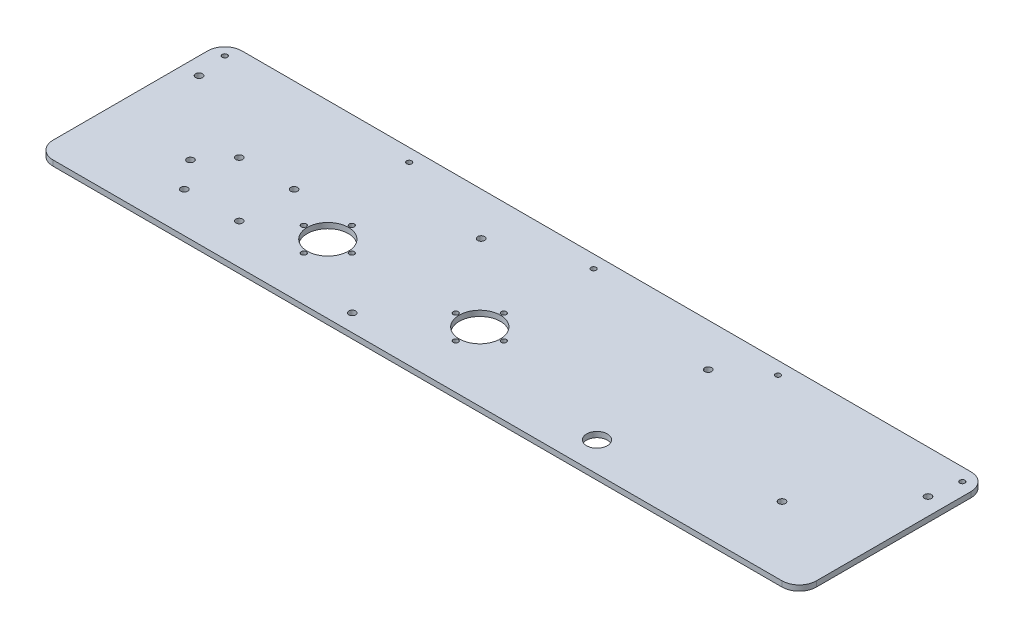
from build123d import *

# Parameters (mm, degrees)
SKETCH1_R           = 2
SKETCH1_R_2         = 1.5
SKETCH1_R_3         = 6
SKETCH1_R_4         = 12
BOSS_EXTRUDE1_DEPTH = 3.175
FILLET1_R           = 10
SKETCH2_R           = 2
CUT_EXTRUDE1_DEPTH  = 10


with BuildPart() as part:
    # Sketch1 → Boss-Extrude1 (new body)
    with BuildSketch(Plane(origin=(0, 0, 0), x_dir=(1, 0, 0), z_dir=(0, 1, 0))):
        Polygon((-26.799577535, 0), (417.700422465, 0), (417.700422465, 17.22815868), (417.700422465, 110), (-26.799577535, 110), align=None)
        with Locations((23.200422465, 40)):
            Circle(SKETCH1_R, mode=Mode.SUBTRACT)
        with Locations((89.200422465, 40)):
            Circle(SKETCH1_R_2, mode=Mode.SUBTRACT)
        with Locations((103.200422465, 26)):
            Circle(SKETCH1_R_2, mode=Mode.SUBTRACT)
        with Locations((117.200422465, 40)):
            Circle(SKETCH1_R_2, mode=Mode.SUBTRACT)
        with Locations((177.700422465, 40)):
            Circle(SKETCH1_R_2, mode=Mode.SUBTRACT)
        with Locations((191.700422465, 26)):
            Circle(SKETCH1_R_2, mode=Mode.SUBTRACT)
        with Locations((205.700422465, 40)):
            Circle(SKETCH1_R_2, mode=Mode.SUBTRACT)
        with Locations((367.700422465, 40)):
            Circle(SKETCH1_R, mode=Mode.SUBTRACT)
        with Locations((147.450422465, 10)):
            Circle(SKETCH1_R, mode=Mode.SUBTRACT)
        with Locations((282.700422465, 17.22815868)):
            Circle(SKETCH1_R_3, mode=Mode.SUBTRACT)
        with Locations((-16.799577535, 85)):
            Circle(SKETCH1_R, mode=Mode.SUBTRACT)
        with Locations((147.450422465, 85)):
            Circle(SKETCH1_R, mode=Mode.SUBTRACT)
        with Locations((103.200422465, 54)):
            Circle(SKETCH1_R_2, mode=Mode.SUBTRACT)
        with Locations((103.200422465, 40)):
            Circle(SKETCH1_R_4, mode=Mode.SUBTRACT)
        with Locations((279.700422465, 85)):
            Circle(SKETCH1_R, mode=Mode.SUBTRACT)
        with Locations((191.700422465, 54)):
            Circle(SKETCH1_R_2, mode=Mode.SUBTRACT)
        with Locations((191.700422465, 40)):
            Circle(SKETCH1_R_4, mode=Mode.SUBTRACT)
        with Locations((407.700422465, 85)):
            Circle(SKETCH1_R, mode=Mode.SUBTRACT)
        with Locations((-19.299577535, 102.5)):
            Circle(SKETCH1_R_2, mode=Mode.SUBTRACT)
        with Locations((88.075422465, 102.5)):
            Circle(SKETCH1_R_2, mode=Mode.SUBTRACT)
        with Locations((195.450422465, 102.5)):
            Circle(SKETCH1_R_2, mode=Mode.SUBTRACT)
        with Locations((302.825422465, 102.5)):
            Circle(SKETCH1_R_2, mode=Mode.SUBTRACT)
        with Locations((410.200422465, 102.5)):
            Circle(SKETCH1_R_2, mode=Mode.SUBTRACT)
    extrude(amount=BOSS_EXTRUDE1_DEPTH)

    # Fillet1
    fillet1_edges = [part.edges().sort_by_distance(p)[0] for p in [
        (417.700422465, 1.5875, -110),
        (417.700422465, 1.5875, 0),
        (-26.799577535, 1.5875, 0),
        (-26.799577535, 1.5875, -110),
    ]]
    fillet(fillet1_edges, radius=FILLET1_R)

    # Sketch2 → Cut-Extrude1 (cut)
    with BuildSketch(Plane(origin=(0, 3.175, 0), x_dir=(1, 0, 0), z_dir=(0, 1, 0))):
        with Locations((36.200422465, 55.40559892)):
            Circle(SKETCH2_R)
        with Locations((68.200422465, 55.40559892)):
            Circle(SKETCH2_R)
        with Locations((68.200422465, 23.40559892)):
            Circle(SKETCH2_R)
        with Locations((36.200422465, 23.40559892)):
            Circle(SKETCH2_R)
    extrude(amount=-CUT_EXTRUDE1_DEPTH, mode=Mode.SUBTRACT)


solid = part.part
